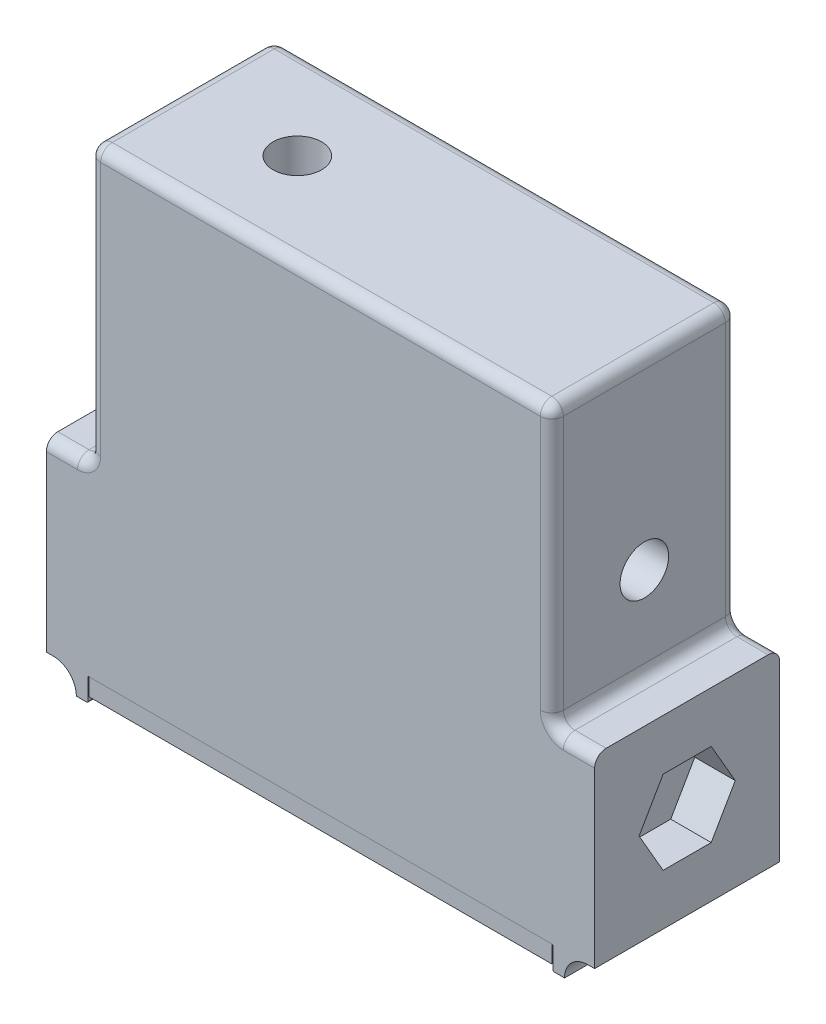
from build123d import *

# Parameters (mm, degrees)
SKETCH1_W               = 40
SKETCH1_H               = 16
BODY_DEPTH              = 40
SKETCH2_W               = 3.7
SKETCH2_H               = 16
EXTENSION_DEPTH         = 16
SKETCH5_W               = 34
SKETCH5_H               = 10
CAVITY_DEPTH            = 37
TOP_HOLE_REACH          = 49.177
SKETCH6_R               = 2.1
SIDE_HOLE_REACH         = 61.78
SKETCH7_R               = 2.1
SKETCH3_W               = 1
SKETCH3_H               = 16
LEGS_DEPTH              = 2
MOUNT_COUNTERBORE_DEPTH = 3.5
F_2MM_LEG_FILLET_R      = 2
F_0_1MM_LEG_FILLET_R    = 0.1
OUTER_BOUNDARY_FILLET_R = 1
INNER_BOUNDARY_FILLET_R = 1
SKETCH8_W               = 40
SKETCH8_H               = 16
BOSS_EXTRUDE1_DEPTH     = 1.5


with BuildPart() as part:
    # Sketch1 → Body (new body)
    with BuildSketch(Plane(origin=(0, 0, 0), x_dir=(1, 0, 0), z_dir=(0, 1, 0))):
        Rectangle(SKETCH1_W, SKETCH1_H)
    extrude(amount=BODY_DEPTH)

    # Sketch2 → Extension (add)
    with BuildSketch(Plane(origin=(0, 0, 0), x_dir=(1, 0, 0), z_dir=(0, 1, 0))):
        with Locations((-21.85, 0)):
            Rectangle(SKETCH2_W, SKETCH2_H)
        with Locations((21.85, 0)):
            Rectangle(SKETCH2_W, SKETCH2_H)
    extrude(amount=EXTENSION_DEPTH)

    # Sketch5 → Cavity (cut)
    with BuildSketch(Plane(origin=(0, 0, 0), x_dir=(1, 0, 0), z_dir=(0, 1, 0))):
        Rectangle(SKETCH5_W, SKETCH5_H)
    extrude(amount=CAVITY_DEPTH, mode=Mode.SUBTRACT)

    # Sketch6 → Top Hole (cut, up to next)
    with BuildSketch(Plane(origin=(0, 40, 0), x_dir=(1, 0, 0), z_dir=(0, 1, 0)), mode=Mode.PRIVATE) as top_hole_sk1:
        with Locations(Location((-10, 0, 0), (0, 0, 270))):
            Circle(SKETCH6_R)
    top_hole_tool1 = extrude(top_hole_sk1.sketch, amount=-TOP_HOLE_REACH, mode=Mode.PRIVATE) & part.part
    add(top_hole_tool1.solids().sort_by_distance((-10, 40, 0))[0], mode=Mode.SUBTRACT)

    # Sketch7 → Side Hole (cut, up to next)
    with BuildSketch(Plane(origin=(20, 0, 0), x_dir=(0, 0, -1), z_dir=(1, 0, 0)), mode=Mode.PRIVATE) as side_hole_sk1:
        with Locations((0, 24)):
            Circle(SKETCH7_R)
    side_hole_tool1 = extrude(side_hole_sk1.sketch, amount=-SIDE_HOLE_REACH, mode=Mode.PRIVATE) & part.part
    add(side_hole_tool1.solids().sort_by_distance((20, 24, 0))[0], mode=Mode.SUBTRACT)

    # Sketch3 → Legs (add)
    with BuildSketch(Plane(origin=(0, 0, 0), x_dir=(1, 0, 0), z_dir=(0, 1, 0))):
        with Locations((-20.6, 0)):
            Rectangle(SKETCH3_W, SKETCH3_H)
        with Locations((20.6, 0)):
            Rectangle(SKETCH3_W, SKETCH3_H)
    extrude(amount=-LEGS_DEPTH)

    # Sketch4 → Mount Counterbore (cut)
    with BuildSketch(Plane.ZY.offset(23.7)):
        Polygon((2.078460969, 11.6), (-2.078460969, 11.6), (-4.156921938, 8), (-2.078460969, 4.4), (2.078460969, 4.4), (4.156921938, 8), align=None)
    mount_counterbore = extrude(amount=-MOUNT_COUNTERBORE_DEPTH, mode=Mode.SUBTRACT)

    # Mount Counterbore Mirror: Mount Counterbore across plane
    add(mount_counterbore.mirror(Plane(origin=(0, 0, 0), x_dir=(0, 0, 1), z_dir=(1, 0, 0))), mode=Mode.SUBTRACT)

    # 2mm Leg Fillet
    f_2mm_leg_fillet_edges = [part.edges().sort_by_distance(p)[0] for p in [
        (-21.1, 0, 0),
        (21.1, 0, 0),
    ]]
    fillet(f_2mm_leg_fillet_edges, radius=F_2MM_LEG_FILLET_R - 0.0001)  # a hair under: the kernel refuses the full size

    # 0.1mm Leg Fillet
    f_0_1mm_leg_fillet_edges = [part.edges().sort_by_distance(p)[0] for p in [
        (-20.1, -2, 0),
        (-20.1, 0, 0),
        (20.1, -2, 0),
        (20.1, 0, 0),
    ]]
    fillet(f_0_1mm_leg_fillet_edges, radius=F_0_1MM_LEG_FILLET_R)

    # Outer Boundary Fillet
    outer_boundary_fillet_edges = [part.edges().sort_by_distance(p)[0] for p in [
        (20, 40, 0),
        (-20, 16, 0),
        (-21.85, 16, -8),
        (0, 40, -8),
        (-21.85, 16, 8),
        (20, 16, 0),
        (21.85, 16, 8),
        (21.85, 16, -8),
        (-20, 40, 0),
        (-20, 28, -8),
        (20, 28, -8),
        (20, 28, 8),
        (-20, 28, 8),
        (0, 40, 8),
    ]]
    fillet(outer_boundary_fillet_edges, radius=OUTER_BOUNDARY_FILLET_R)

    # Inner Boundary Fillet
    inner_boundary_fillet_edges = [part.edges().sort_by_distance(p)[0] for p in [
        (-17, 18.5, -5),
        (-17, 18.5, 5),
        (17, 18.5, 5),
        (17, 18.5, -5),
        (-17, 37, 0),
        (0, 37, 5),
        (17, 37, 0),
        (0, 37, -5),
    ]]
    fillet(inner_boundary_fillet_edges, radius=INNER_BOUNDARY_FILLET_R)


with BuildPart() as body_2:
    # Sketch8 → Boss-Extrude1 (new body)
    with BuildSketch(Plane.XZ):
        Rectangle(SKETCH8_W, SKETCH8_H)
        with BuildLine():
            Line((-16, -5), (16, -5))
            ThreePointArc((16, -5), (16.707106781, -4.707106781), (17, -4))
            Line((17, -4), (17, 4))
            ThreePointArc((17, 4), (16.707106781, 4.707106781), (16, 5))
            Line((16, 5), (-16, 5))
            ThreePointArc((-16, 5), (-16.707106781, 4.707106781), (-17, 4))
            Line((-17, 4), (-17, -4))
            ThreePointArc((-17, -4), (-16.707106781, -4.707106781), (-16, -5))
        make_face(mode=Mode.SUBTRACT)
    extrude(amount=BOSS_EXTRUDE1_DEPTH)


solid = Compound([part.part, body_2.part])
